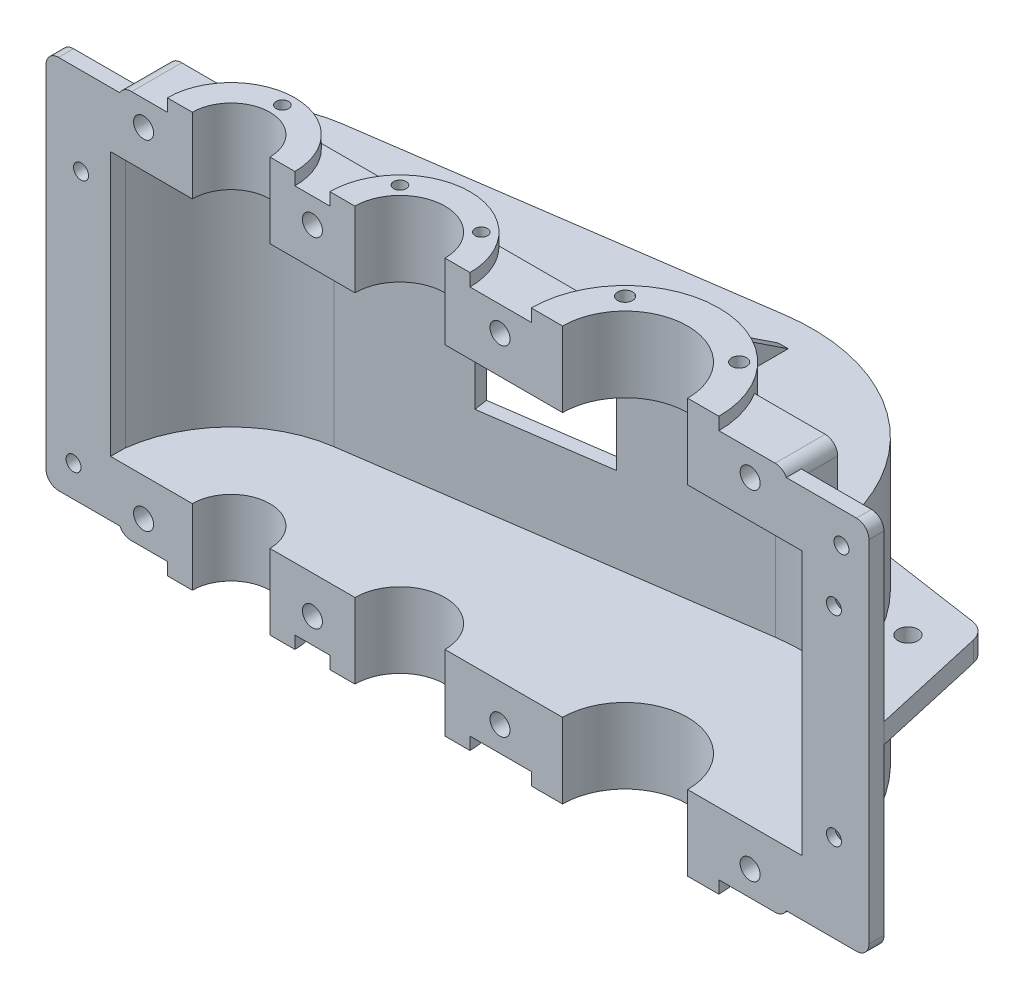
from build123d import *

# Parameters (mm, degrees)
EXTRUDE_1_DEPTH      = 12
EXTRUDE_2_DEPTH      = 113.5
CUT_EXTRUDE_1_DEPTH  = 105.5
SKETCH_7_W           = 552.909319145
SKETCH_7_H           = 211
CUT_EXTRUDE_4_DEPTH  = 12
SKETCH_8_R           = 75
SKETCH_8_R_2         = 50
SKETCH_8_R_3         = 56
SKETCH_8_R_4         = 36
SKETCH_8_R_5         = 51
SKETCH_8_R_6         = 31
EXTRUDE_3_DEPTH      = 60
CUT_EXTRUDE_START    = -60
CUT_EXTRUDE_6_DEPTH  = 60
SKETCH_12_W          = 68
SKETCH_12_H          = 50
SKETCH_12_W_2        = 94
EXTRUDE_5_DEPTH      = 40
RIB_6_REACH          = 512.689
SKETCH_15_WALL_W     = 1085.050505142
SKETCH_15_WALL_H     = 8
RIB_START            = -8
RIB_8_DEPTH          = 16
RIB_9_DEPTH          = 16
SKETCH_20_R          = 8
CUT_EXTRUDE_7_DEPTH  = 40
SKETCH_28_R          = 6
CUT_EXTRUDE_10_DEPTH = 418.849554266
SKETCH_29_R          = 13
CUT_EXTRUDE_11_DEPTH = 5
SKETCH_31_R          = 6
CUT_EXTRUDE_12_DEPTH = 15
SKETCH_30_R          = 7.5
EXTRUDE_6_DEPTH      = 3
SKETCH_32_W          = 100
SKETCH_32_H          = 75
CUT_EXTRUDE_13_DEPTH = 19
SKETCH_34_R          = 6
SKETCH_34_R_2        = 5
CUT_EXTRUDE_14_DEPTH = 35
SKETCH_37_R          = 8
CUT_EXTRUDE_15_DEPTH = 40
SKETCH_38_R          = 16
CUT_EXTRUDE_16_DEPTH = 4


# Read off the part's stored shape, not the designer's step: 筋8, 筋9
with BuildPart() as part:
    # 草图1 → 凸台-拉伸1 (new body)
    with BuildSketch(Plane.XY):
        with BuildLine():
            Line((-348, 150), (290, 150))
            ThreePointArc((290, 150), (297.071067812, 147.071067812), (300, 140))
            Line((300, 140), (300, -140))
            ThreePointArc((300, -140), (297.071067812, -147.071067812), (290, -150))
            Line((290, -150), (-348, -150))
            ThreePointArc((-348, -150), (-355.071067812, -147.071067812), (-358, -140))
            Line((-358, -140), (-358, 140))
            ThreePointArc((-358, 140), (-355.071067812, 147.071067812), (-348, 150))
        make_face()
    extrude(amount=EXTRUDE_1_DEPTH)

    # 草图2 → 凸台-拉伸2 (add, symmetric)
    with BuildSketch(Plane(origin=(0, 0, 0), x_dir=(1, 0, 0), z_dir=(0, 1, 0))):
        with BuildLine():
            Line((-225, 91.923048454), (83.571428571, 136.461497792))
            ThreePointArc((83.571428571, 136.461497792), (203.198050606, 101.389341903), (255, -12))
            Line((255, -12), (-315, -12))
            ThreePointArc((-315, -12), (-289.372539332, 56.738635424), (-225, 91.923048454))
        make_face()
    extrude(amount=EXTRUDE_2_DEPTH, both=True)

    # 草图3 → 切除-拉伸1 (cut, symmetric)
    with BuildSketch(Plane(origin=(0, 0, 0), x_dir=(1, 0, 0), z_dir=(0, 1, 0))):
        with BuildLine():
            Line((84.714285714, 128.543551243), (-223.857142857, 84.005101905))
            ThreePointArc((-223.857142857, 84.005101905), (-279.570291072, 55.594190579), (-306.364448521, -0.914285714))
            Line((-306.364448521, -0.914285714), (246.544870624, -0.64))
            ThreePointArc((246.544870624, -0.64), (193.589182336, 98.977280437), (84.714285714, 128.543551243))
        make_face()
    extrude(amount=CUT_EXTRUDE_1_DEPTH, both=True, mode=Mode.SUBTRACT)

    # 草图7 → 切除-拉伸4 (cut)
    with BuildSketch(Plane(origin=(0, 0, 0), x_dir=(-1, 0, 0), z_dir=(0, 0, -1))):
        with Locations((29.909788949, 0)):
            Rectangle(SKETCH_7_W, SKETCH_7_H)
    extrude(amount=-CUT_EXTRUDE_4_DEPTH, mode=Mode.SUBTRACT)

    # 草图8 → 凸台-拉伸3 (add)
    # profile 1 of 3: a face of its own
    with BuildSketch(Plane(origin=(0, -105.5, 0), x_dir=(1, 0, 0), z_dir=(0, 1, 0))):
        with Locations(Location((105, -12, 0), (0, 0, 270))):
            Circle(SKETCH_8_R)
        with Locations(Location((105, -12, 0), (0, 0, 270))):
            Circle(SKETCH_8_R_2, mode=Mode.SUBTRACT)
    # profile 2 of 3: a face of its own
    with BuildSketch(Plane(origin=(0, -105.5, 0), x_dir=(1, 0, 0), z_dir=(0, 1, 0))):
        with Locations(Location((-75, -12, 0), (0, 0, 270))):
            Circle(SKETCH_8_R_3)
        with Locations(Location((-75, -12, 0), (0, 0, 270))):
            Circle(SKETCH_8_R_4, mode=Mode.SUBTRACT)
    # profile 3 of 3: a face of its own
    with BuildSketch(Plane(origin=(0, -105.5, 0), x_dir=(1, 0, 0), z_dir=(0, 1, 0))):
        with Locations(Location((-210, -12, 0), (0, 0, 270))):
            Circle(SKETCH_8_R_5)
        with Locations(Location((-210, -12, 0), (0, 0, 270))):
            Circle(SKETCH_8_R_6, mode=Mode.SUBTRACT)
    extrude_3 = extrude(amount=-EXTRUDE_3_DEPTH)

    # 草图9 → 切除-拉伸6 (cut)
    with BuildSketch(Plane.XZ.offset(165.5).offset(CUT_EXTRUDE_START)):
        with BuildLine():
            Line((180, 12), (155, 12))
            ThreePointArc((155, 12), (105, -38), (55, 12))
            Line((55, 12), (30, 12))
            ThreePointArc((30, 12), (105, 87), (180, 12))
        make_face()
        with BuildLine():
            Line((-39, 12), (-19, 12))
            ThreePointArc((-19, 12), (-75, 68), (-131, 12))
            Line((-131, 12), (-111, 12))
            ThreePointArc((-111, 12), (-75, -24), (-39, 12))
        make_face()
        with BuildLine():
            Line((-159, 12), (-179, 12))
            ThreePointArc((-179, 12), (-210, -19), (-241, 12))
            Line((-241, 12), (-261, 12))
            ThreePointArc((-261, 12), (-210, 63), (-159, 12))
        make_face()
    cut_extrude_6 = extrude(amount=CUT_EXTRUDE_6_DEPTH, mode=Mode.SUBTRACT)

    # 镜向1: 凸台-拉伸3, 切除-拉伸6 across plane
    add(extrude_3.mirror(Plane.ZX))
    add(cut_extrude_6.mirror(Plane.ZX), mode=Mode.SUBTRACT)

    # 草图12 → 凸台-拉伸5 (add)
    with BuildSketch(Plane.XY.offset(12)):
        with BuildLine():
            Line((-241, 155.5), (-241, 105.5))
            Line((-241, 105.5), (-300, 105.5))
            Line((-300, 105.5), (-300, 145.5))
            ThreePointArc((-300, 145.5), (-296.90812345, 152.741231598), (-289.533550068, 155.5))
            Line((-289.533550068, 155.5), (-241, 155.5))
        make_face()
        with BuildLine():
            Line((155, 155.5), (225, 155.5))
            ThreePointArc((225, 155.5), (232.071067812, 152.571067812), (235, 145.5))
            Line((235, 145.5), (235, 105.5))
            Line((235, 105.5), (155, 105.5))
            Line((155, 105.5), (155, 155.5))
        make_face()
        with Locations((-145, 130.5)):
            Rectangle(SKETCH_12_W, SKETCH_12_H)
        with Locations((8, 130.5)):
            Rectangle(SKETCH_12_W_2, SKETCH_12_H)
    extrude_5 = extrude(amount=-EXTRUDE_5_DEPTH)

    # 镜向2: 凸台-拉伸5 across plane
    add(extrude_5.mirror(Plane.ZX))

    # 草图15 wall → 筋6 (add, up to next)
    with BuildSketch(Plane(origin=(105, 130.493877833, -88.730971103), x_dir=(0, -0.551100534897, -0.834438853623), z_dir=(0, 0.834438853623, -0.551100534897)), mode=Mode.PRIVATE) as rib_6_sk1:
        Rectangle(SKETCH_15_WALL_W, SKETCH_15_WALL_H)
    rib_6_tool1 = extrude(rib_6_sk1.sketch, amount=-RIB_6_REACH, mode=Mode.PRIVATE) - part.part
    add(rib_6_tool1.solids().sort_by_distance((105, 130.493877833, -88.730971103))[0])

    # 筋8 outline → 筋8 (add)
    with BuildSketch(Plane(origin=(0, 0, 0), x_dir=(1, 0, 0), z_dir=(0, 1, 0)).offset(RIB_START)):
        with BuildLine():
            Line((265.845991104, 104.887713511), (180.767058349, 117.457919299))
            ThreePointArc((180.767058349, 117.457919299), (232.033730082, 67.764850791), (254.519229533, 0))
            Line((254.519229533, 0), (300, 0))
            Line((300, 0), (279.115214142, 92.580430103))
            ThreePointArc((279.115214142, 92.580430103), (274.387920947, 100.790466496), (265.845991104, 104.887713511))
        make_face()
    extrude(amount=RIB_8_DEPTH)

    # 筋9 outline → 筋9 (add)
    with BuildSketch(Plane(origin=(0, 0, 0), x_dir=(1, 0, 0), z_dir=(0, 1, 0)).offset(RIB_START)):
        with BuildLine():
            ThreePointArc((-314.312031904, 0), (-304.874938142, 32.986065759), (-285.308047037, 61.168969184))
            Line((-285.308047037, 61.168969184), (-323.439828083, 57.154836477))
            ThreePointArc((-323.439828083, 57.154836477), (-330.25503224, 54.804299637), (-335.346578212, 49.700556818))
            Line((-335.346578212, 49.700556818), (-358, 0))
            Line((-358, 0), (-314.312031904, 0))
        make_face()
    extrude(amount=RIB_9_DEPTH)

    # 草图20 → 切除-拉伸7 (cut)
    with BuildSketch(Plane(origin=(0, 8, 0), x_dir=(1, 0, 0), z_dir=(0, 1, 0))):
        with Locations(Location((249.555155033, 69.607641513, 0), (0, 0, 270))):
            Circle(SKETCH_20_R)
        with Locations(Location((-318.867914099, 40.808875009, 0), (0, 0, 270))):
            Circle(SKETCH_20_R)
    extrude(amount=-CUT_EXTRUDE_7_DEPTH, mode=Mode.SUBTRACT)

    # 草图24 → 切除-旋转1 (revolve, cut)
    with BuildSketch(Plane(origin=(0, -125, 0), x_dir=(-1, 0, 0), z_dir=(0, -1, 0))):
        Polygon((330, 1), (330.05, -25), (336, -25), (336, 1), align=None)
    revolve(axis=Axis((-336, -125, -4.74869217), (0, 0, 1)), mode=Mode.SUBTRACT)

    # 草图27 → 切除-旋转2 (revolve, cut)
    with BuildSketch(Plane(origin=(0, 125, 0), x_dir=(1, 0, 0), z_dir=(0, 1, 0)), mode=Mode.PRIVATE) as cut_revolve_2_sk:
        Polygon((272, 1), (272.05, -22.073916869), (278, -22.073916869), (278, 1), align=None)
    revolve(cut_revolve_2_sk.sketch.rotate(Axis((278, 125, -7.194314205), (0, 0, 1)), 180), axis=Axis((278, 125, -7.194314205), (0, 0, 1)), mode=Mode.SUBTRACT)

    # 草图28 → 切除-拉伸10 (cut, through all)
    with BuildSketch(Plane(origin=(0, 0, 0), x_dir=(-1, 0, 0), z_dir=(0, 0, -1))):
        with Locations((-272, -80)):
            Circle(SKETCH_28_R)
    cut_extrude_10 = extrude(amount=-CUT_EXTRUDE_10_DEPTH, mode=Mode.SUBTRACT)

    # 草图29 → 切除-拉伸11 (cut)
    with BuildSketch(Plane(origin=(0, 0, 0), x_dir=(-1, 0, 0), z_dir=(0, 0, -1))):
        with Locations((-272, -80)):
            Circle(SKETCH_29_R)
    cut_extrude_11 = extrude(amount=-CUT_EXTRUDE_11_DEPTH, mode=Mode.SUBTRACT)

    # 镜向5: 切除-拉伸10, 切除-拉伸11 across plane
    add(cut_extrude_10.mirror(Plane.ZX), mode=Mode.SUBTRACT)
    add(cut_extrude_11.mirror(Plane.ZX), mode=Mode.SUBTRACT)

    # 草图31 → 切除-拉伸12 (cut)
    with BuildSketch(Plane(origin=(0, 0, 0), x_dir=(-1, 0, 0), z_dir=(0, 0, -1))):
        with Locations((330, 80)):
            Circle(SKETCH_31_R)
    extrude(amount=-CUT_EXTRUDE_12_DEPTH, mode=Mode.SUBTRACT)

    # 草图30 → 凸台-拉伸6 (add)
    with BuildSketch(Plane(origin=(-17.589011454, 0, -121.860245972), x_dir=(-0.989743318610787, 0, 0.14285714285714285), z_dir=(-0.14285714285714285, 0, -0.989743318610787))):
        with BuildLine():
            Line((-10, 67.5), (130, 67.5))
            ThreePointArc((130, 67.5), (137.071067812, 64.571067812), (140, 57.5))
            Line((140, 57.5), (140, -57.5))
            ThreePointArc((140, -57.5), (137.071067812, -64.571067812), (130, -67.5))
            Line((130, -67.5), (-10, -67.5))
            ThreePointArc((-10, -67.5), (-17.071067812, -64.571067812), (-20, -57.5))
            Line((-20, -57.5), (-20, 57.5))
            ThreePointArc((-20, 57.5), (-17.071067812, 64.571067812), (-10, 67.5))
        make_face()
        with Locations((-5, 52.5)):
            Circle(SKETCH_30_R, mode=Mode.SUBTRACT)
        with Locations(Location((-5, -52.5, 0), (0, 0, 180))):
            Circle(SKETCH_30_R, mode=Mode.SUBTRACT)
        with Locations(Location((125, 52.5, 0), (0, 0, 180))):
            Circle(SKETCH_30_R, mode=Mode.SUBTRACT)
        with Locations((125, -52.5)):
            Circle(SKETCH_30_R, mode=Mode.SUBTRACT)
    extrude(amount=EXTRUDE_6_DEPTH)

    # 草图32 → 切除-拉伸13 (cut)
    with BuildSketch(Plane(origin=(-18.017582882, 0, -124.829475927), x_dir=(-0.989743318610787, 0, 0.14285714285714285), z_dir=(-0.14285714285714285, 0, -0.989743318610787))):
        with Locations((60, 0)):
            Rectangle(SKETCH_32_W, SKETCH_32_H)
    extrude(amount=-CUT_EXTRUDE_13_DEPTH, mode=Mode.SUBTRACT)

    # 草图34 → 切除-拉伸14 (cut)
    with BuildSketch(Plane.XZ.offset(165.5)):
        with Locations(Location((59.391612613, -33.608387387, 0), (0, 0, 270))):
            Circle(SKETCH_34_R)
        with Locations(Location((-107.526911935, -20.526911935, 0), (0, 0, 270))):
            Circle(SKETCH_34_R_2)
        with Locations(Location((-210, -29, 0), (0, 0, 270))):
            Circle(SKETCH_34_R_2)
        with Locations(Location((-42.473088065, -20.526911935, 0), (0, 0, 90))):
            Circle(SKETCH_34_R_2)
        with Locations(Location((150.608387387, -33.608387387, 0), (0, 0, 90))):
            Circle(SKETCH_34_R)
    cut_extrude_14 = extrude(amount=-CUT_EXTRUDE_14_DEPTH, mode=Mode.SUBTRACT)

    # 镜向6: 切除-拉伸14 across plane
    add(cut_extrude_14.mirror(Plane.ZX), mode=Mode.SUBTRACT)

    # 草图37 → 切除-拉伸15 (cut)
    with BuildSketch(Plane(origin=(0, 0, -28), x_dir=(-1, 0, 0), z_dir=(0, 0, -1))):
        with Locations((280, 135.5)):
            Circle(SKETCH_37_R)
        with Locations((145, 135.5)):
            Circle(SKETCH_37_R)
        with Locations((-5, 135.5)):
            Circle(SKETCH_37_R)
        with Locations((-205, 135.5)):
            Circle(SKETCH_37_R)
    cut_extrude_15 = extrude(amount=-CUT_EXTRUDE_15_DEPTH, mode=Mode.SUBTRACT)

    # 草图38 → 切除-拉伸16 (cut)
    with BuildSketch(Plane(origin=(0, 0, -28), x_dir=(-1, 0, 0), z_dir=(0, 0, -1))):
        with Locations((-205, 135.5)):
            Circle(SKETCH_38_R)
        with Locations((-5, 135.5)):
            Circle(SKETCH_38_R)
        with Locations((145, 135.5)):
            Circle(SKETCH_38_R)
        with Locations((280, 135.5)):
            Circle(SKETCH_38_R)
    cut_extrude_16 = extrude(amount=-CUT_EXTRUDE_16_DEPTH, mode=Mode.SUBTRACT)

    # 镜向7: 切除-拉伸15, 切除-拉伸16 across plane
    add(cut_extrude_15.mirror(Plane.ZX), mode=Mode.SUBTRACT)
    add(cut_extrude_16.mirror(Plane.ZX), mode=Mode.SUBTRACT)


solid = part.part
